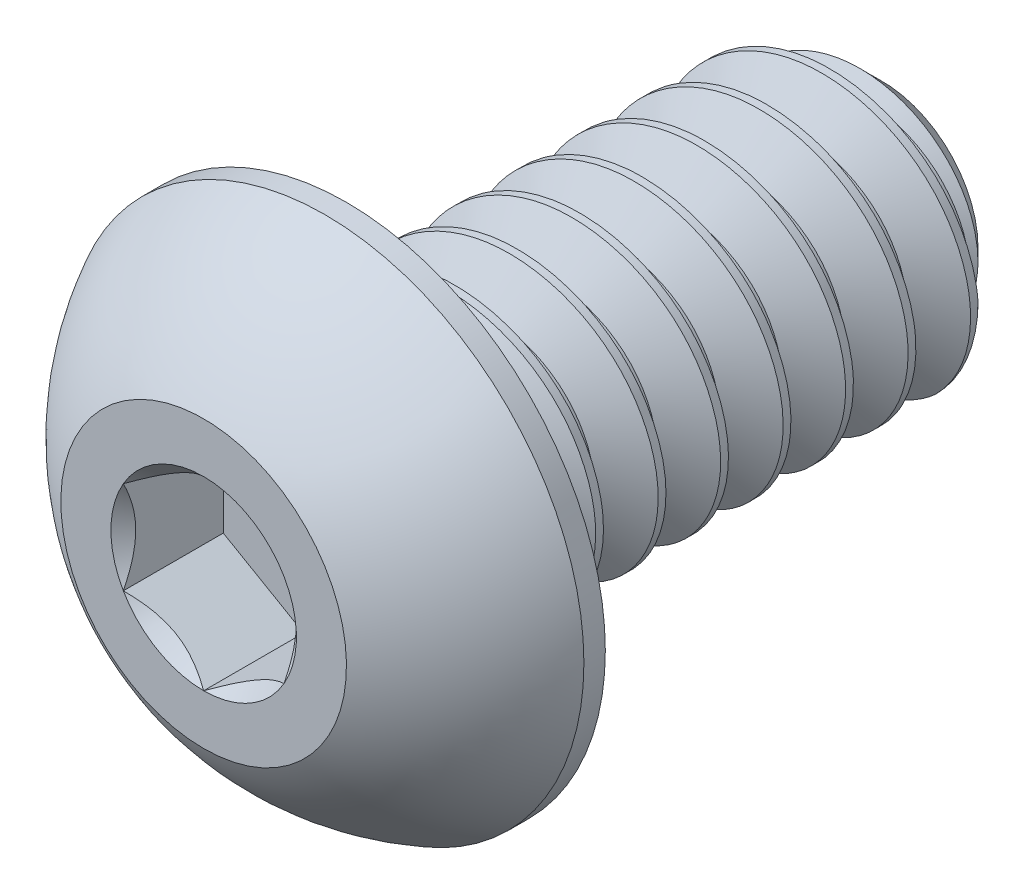
from build123d import *

# Parameters (mm, degrees)
CUT_EXTRUDE2_DEPTH = 0.56
CUT_SWEEP2_PITCH   = 0.35
CUT_SWEEP2_TO      = 3


with BuildPart() as part:
    # Sketch10 → Revolve3 (revolve)
    with BuildSketch(Plane(origin=(0, 0, 0), x_dir=(0, 0, -1), z_dir=(1, 0, 0)), mode=Mode.PRIVATE) as revolve3_sk:
        Polygon((3.5375, 0.8), (3.8, 0.5375), (3.8, 0), (0.8, 0), (0.8, 0.8), align=None)
    revolve(revolve3_sk.sketch.rotate(Axis((0, 0, 0), (0, 0, -1)), 90), axis=Axis((0, 0, 0), (0, 0, -1)))

    # Sketch7 → Revolve2 (revolve)
    with BuildSketch(Plane(origin=(0, 0, 0), x_dir=(0, 0, -1), z_dir=(1, 0, 0)), mode=Mode.PRIVATE) as revolve2_sk:
        with BuildLine():
            Line((0.68, 1.45), (0.8, 1.45))
            Line((0.8, 1.45), (0.8, 0))
            Line((0.8, 0), (0, 0))
            Line((0, 0), (0, 0.8))
            ThreePointArc((0, 0.8), (0.291961854, 1.175255291), (0.68, 1.45))
        make_face()
    revolve(revolve2_sk.sketch.rotate(Axis((0, 0, 0), (0, 0, -1)), 180), axis=Axis((0, 0, 0), (0, 0, -1)))

    # Sketch5 → Cut-Extrude2 (cut)
    with BuildSketch(Plane.XY):
        Polygon((0.45, -0.259807621), (0.45, 0.259807621), (0, 0.519615242), (-0.45, 0.259807621), (-0.45, -0.259807621), (0, -0.519615242), align=None)
    extrude(amount=-CUT_EXTRUDE2_DEPTH, mode=Mode.SUBTRACT)

    # Cut-Extrude3 cone 1 section (through the dimple's axis) → Cut-Extrude3 (revolve, cut)
    with BuildSketch(Plane(origin=(0, 0, 0), x_dir=(0, -1, 0), z_dir=(1, 0, 0))):
        Polygon((0, 0), (0.519615242, 0), (0, 0.519615242), align=None)
    revolve(axis=Axis((0, 0, 0), (0, 0, -1)), mode=Mode.SUBTRACT)


with BuildPart() as body_2:
    # Split1: read off the stored shape, not the designer's step
    # Split1: the piece on the far side of the plane
    add(part.part)
    split(bisect_by=Plane.XY.offset(-0.8), keep=Keep.BOTTOM)

    # Cut-Sweep2: arcs per turn and ends read off the stored shape
    # Cut-Sweep2: the profile of Sketch12 screwed along a right-hand helix through 12 turns, 6 arcs to a turn; built about Z, then put on its axis
    cut_sweep2_z = Axis((0, 0, 0), (0, 0, 1))
    cut_sweep2_corners = [(0.572668332, 0, -0.13125), (0.572668332, 0, -0.175), (0.818944306, 0, -0.3171875), (0.818944306, 0, 0.0109375)]
    with BuildLine(mode=Mode.PRIVATE) as cut_sweep2_profile:
        Line(cut_sweep2_corners[0], cut_sweep2_corners[1])
        Line(cut_sweep2_corners[1], cut_sweep2_corners[2])
        Line(cut_sweep2_corners[2], cut_sweep2_corners[3])
        Line(cut_sweep2_corners[3], cut_sweep2_corners[0])
    cut_sweep2_cap = Face(cut_sweep2_profile.wire())
    cut_sweep2_turn_angles = [0, 30, 60, 90, 120, 150, 180, 210, 240, 270, 300, 330, 360]
    cut_sweep2_turn_weights = [1, 0.8660254037844387, 1, 0.8660254037844387, 1, 0.8660254037844387, 1, 0.8660254037844387, 1, 0.8660254037844387, 1, 0.8660254037844387, 1]
    cut_sweep2_turn_rails = [Edge.make_bspline([Vector(p[0], p[1], 0).rotate(cut_sweep2_z, cut_sweep2_turn_angles[k]) / cut_sweep2_turn_weights[k] + Vector(0, 0, p[2] + CUT_SWEEP2_PITCH * cut_sweep2_turn_angles[k] / 360) for k in range(13)], [0, 0, 0, 1, 1, 2, 2, 3, 3, 4, 4, 5, 5, 6, 6, 6], 2, cut_sweep2_turn_weights) for p in cut_sweep2_corners]
    cut_sweep2_turn_sides = [Face.make_surface_from_curves(cut_sweep2_turn_rails[p[0]], cut_sweep2_turn_rails[p[1]]) for p in [(0, 1), (1, 2), (2, 3), (3, 0)]]
    cut_sweep2 = Plane(origin=(0, 0, -3.8), x_dir=(0, 1, 0), z_dir=(0, 0, 1)) * split(Solid(Shell([*[p.moved(Location((0, 0, CUT_SWEEP2_PITCH * i))) for i in range(12) for p in cut_sweep2_turn_sides], cut_sweep2_cap, cut_sweep2_cap.rotate(cut_sweep2_z, 4320).moved(Location((0, 0, CUT_SWEEP2_PITCH * 4320 / 360)))])), bisect_by=Plane.XY.offset(CUT_SWEEP2_TO), keep=Keep.BOTTOM, mode=Mode.PRIVATE)
    add(cut_sweep2, mode=Mode.SUBTRACT)


with BuildPart() as part_1:
    add(part.part)

    # Split1
    split(bisect_by=Plane.XY.offset(-0.8), keep=Keep.TOP)

    add(body_2.part)  # Boss-Extrude1 merges body 2
    # Boss-Extrude1 cone 1 section (through the dimple's axis) → Boss-Extrude1 (revolve)
    with BuildSketch(Plane(origin=(0, 0, -0.8), x_dir=(0, -1, 0), z_dir=(1, 0, 0))):
        Polygon((0, 0), (0.8, 0), (0, 0.8), align=None)
    revolve(axis=Axis((0, 0, -0.8), (0, 0, -1)))


solid = part_1.part
